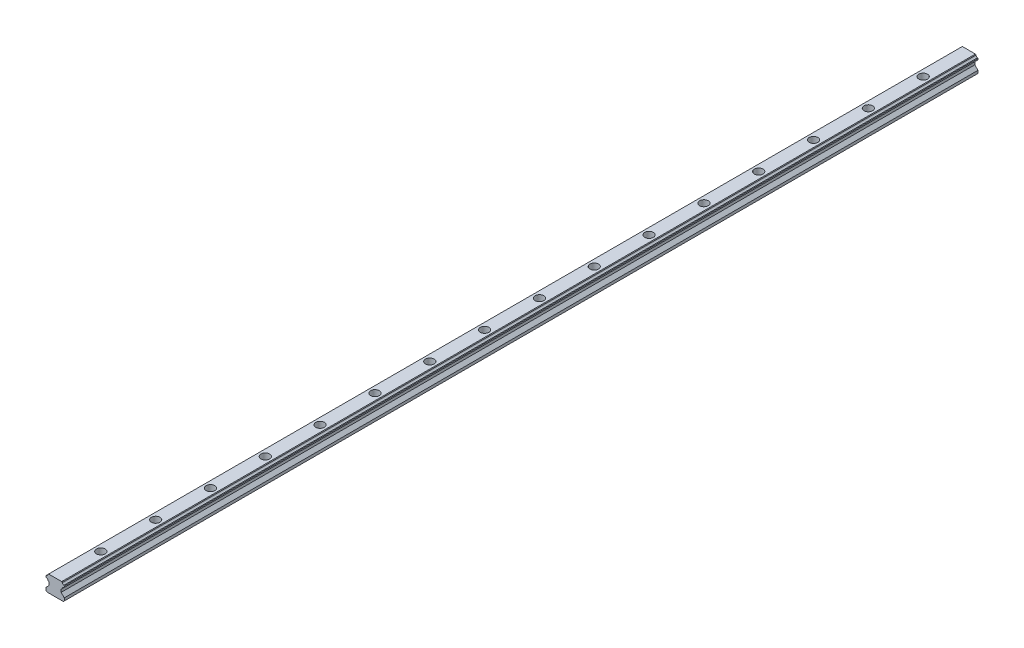
from build123d import *

# Parameters (mm, degrees)
BOSS_EXTRUDE1_DEPTH = 500
SKETCH2_R           = 3
CUT_EXTRUDE1_DEPTH  = 501.423820376
SKETCH3_R           = 4.75
CUT_EXTRUDE2_DEPTH  = 8.5
LPATTERN1_COUNT     = 100
LPATTERN1_PITCH     = 60


with BuildPart() as part:
    # Sketch1 → Boss-Extrude1 (new body)
    with BuildSketch(Plane.XY):
        with BuildLine():
            Line((-6.55, 1.465), (-6.55, -1.465))
            Line((-6.55, -1.465), (-10, -4.915))
            Line((-10, -4.915), (-10, -7.915))
            Line((-10, -7.915), (-9, -8.915))
            Line((-9, -8.915), (0, -8.915))
            Line((0, -8.915), (0, 9.085))
            Line((0, 9.085), (-7.16, 9.085))
            Line((-7.16, 9.085), (-7.768111832, 8.476888168))
            ThreePointArc((-7.768111832, 8.476888168), (-8.334356479, 7.341574733), (-9.469669914, 6.775330086))
            Line((-9.469669914, 6.775330086), (-10, 6.245))
            Line((-10, 6.245), (-10, 4.915))
            Line((-10, 4.915), (-9.469669914, 4.384669914))
            ThreePointArc((-9.469669914, 4.384669914), (-8.334356479, 3.818425267), (-7.768111832, 2.683111832))
            Line((-7.768111832, 2.683111832), (-6.55, 1.465))
        make_face()
    boss_extrude1 = extrude(amount=BOSS_EXTRUDE1_DEPTH)

    # Mirror1: Boss-Extrude1 across plane
    add(boss_extrude1.mirror(Plane(origin=(0, 9.085, 500), x_dir=(0, 0, 1), z_dir=(-1, 0, 0))))

    # Sketch2 → Cut-Extrude1 (cut, through all)
    with BuildSketch(Plane(origin=(0, 9.085, 0), x_dir=(1, 0, 0), z_dir=(0, 1, 0))):
        with Locations((0, -30)):
            Circle(SKETCH2_R)
    cut_extrude1 = extrude(amount=-CUT_EXTRUDE1_DEPTH, mode=Mode.SUBTRACT)

    # Sketch3 → Cut-Extrude2 (cut)
    with BuildSketch(Plane(origin=(0, 9.085, 0), x_dir=(1, 0, 0), z_dir=(0, 1, 0))):
        with Locations((0, -30)):
            Circle(SKETCH3_R)
    cut_extrude2 = extrude(amount=-CUT_EXTRUDE2_DEPTH, mode=Mode.SUBTRACT)

    # LPattern1: Cut-Extrude1, Cut-Extrude2 ×100
    with Locations(*[(0, 0, i * LPATTERN1_PITCH) for i in range(1, LPATTERN1_COUNT)]):
        add(cut_extrude1, mode=Mode.SUBTRACT)
        add(cut_extrude2, mode=Mode.SUBTRACT)

    # Mirror2: part across plane


with BuildPart() as part_1:
    add(part.part)
    add(part.part.mirror(Plane(origin=(-9.748570041, 2.404211705, 0), x_dir=(1, 0, 0), z_dir=(0, 0, -1))))


solid = part_1.part
